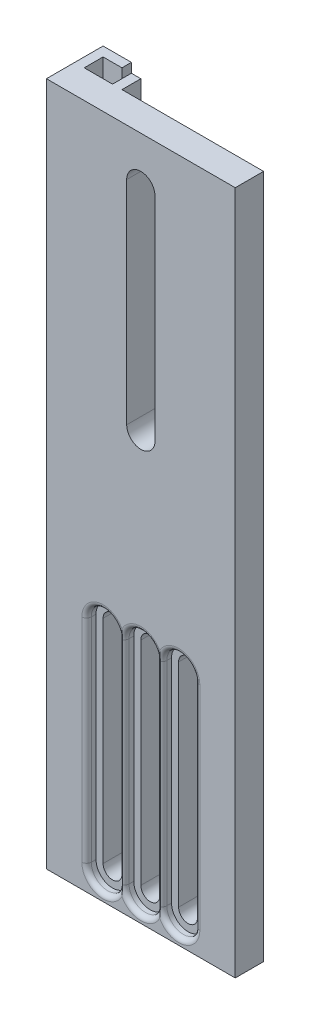
from build123d import *

# Parameters (mm, degrees)
SKETCH_1_W          = 40
SKETCH_1_H          = 160
EXTRUDE_2_DEPTH     = 6
CUT_EXTRUDE_3_DEPTH = 10
SKETCH_5_W          = 40
SKETCH_5_H          = 15
CUT_EXTRUDE_4_DEPTH = 10
CUT_EXTRUDE_5_DEPTH = 10
CUT_EXTRUDE_6_DEPTH = 2
FILLET_1_R          = 1
SKETCH_10_W         = 10
SKETCH_10_H         = 60
EXTRUDE_3_DEPTH     = 4
SKETCH_11_W         = 6
SKETCH_11_H         = 60
CUT_EXTRUDE_7_DEPTH = 4
SKETCH_13_W         = 6
SKETCH_13_H         = 29
EXTRUDE_9_DEPTH     = 2


with BuildPart() as part:
    # Эскиз1 → Бобышка-Вытянуть2 (new body)
    with BuildSketch(Plane.XY):
        Rectangle(SKETCH_1_W, SKETCH_1_H)
    extrude(amount=EXTRUDE_2_DEPTH)

    # Эскиз3 → Вырез-Вытянуть3 (cut)
    with BuildSketch(Plane.XY.offset(6)):
        with BuildLine():
            Line((-3, 55), (-3, 10))
            ThreePointArc((-3, 10), (0, 7), (3, 10))
            Line((3, 10), (3, 55))
            ThreePointArc((3, 55), (0, 58), (-3, 55))
        make_face()
    extrude(amount=-CUT_EXTRUDE_3_DEPTH, mode=Mode.SUBTRACT)

    # Эскиз5 → Вырез-Вытянуть4 (cut)
    with BuildSketch(Plane.XY.offset(6)):
        with Locations((0, 72.5)):
            Rectangle(SKETCH_5_W, SKETCH_5_H)
    extrude(amount=-CUT_EXTRUDE_4_DEPTH, mode=Mode.SUBTRACT)

    # Эскиз7 → Вырез-Вытянуть5 (cut)
    with BuildSketch(Plane.XY.offset(6)):
        with BuildLine():
            Line((-10, -30), (-10, -75))
            ThreePointArc((-10, -75), (-8, -77), (-6, -75))
            Line((-6, -75), (-6, -30))
            ThreePointArc((-6, -30), (-8, -28), (-10, -30))
        make_face()
        with BuildLine():
            Line((-2, -75), (-2, -30))
            ThreePointArc((-2, -30), (0, -28), (2, -30))
            Line((2, -30), (2, -75))
            ThreePointArc((2, -75), (0, -77), (-2, -75))
        make_face()
        with BuildLine():
            Line((6, -75), (6, -30))
            ThreePointArc((6, -30), (8, -28), (10, -30))
            Line((10, -30), (10, -75))
            ThreePointArc((10, -75), (8, -77), (6, -75))
        make_face()
    extrude(amount=-CUT_EXTRUDE_5_DEPTH, mode=Mode.SUBTRACT)

    # Эскиз8 → Вырез-Вытянуть6 (cut)
    # profile 1 of 3: a face of its own
    with BuildSketch(Plane.XY.offset(6)):
        with BuildLine():
            ThreePointArc((-11.5, -30), (-8, -26.5), (-4.5, -30))
            Line((-4.5, -30), (-4.5, -75))
            ThreePointArc((-4.5, -75), (-8, -78.5), (-11.5, -75))
            Line((-11.5, -75), (-11.5, -30))
        make_face()
        with BuildLine():
            Line((-10, -75), (-10, -30))
            ThreePointArc((-10, -30), (-8, -28), (-6, -30))
            Line((-6, -30), (-6, -75))
            ThreePointArc((-6, -75), (-8, -77), (-10, -75))
        make_face(mode=Mode.SUBTRACT)
    # profile 2 of 3: a face of its own
    with BuildSketch(Plane.XY.offset(6)):
        with BuildLine():
            ThreePointArc((-3.5, -30), (0, -26.5), (3.5, -30))
            Line((3.5, -30), (3.5, -75))
            ThreePointArc((3.5, -75), (0, -78.5), (-3.5, -75))
            Line((-3.5, -75), (-3.5, -30))
        make_face()
        with BuildLine():
            ThreePointArc((2, -75), (0, -77), (-2, -75))
            Line((-2, -75), (-2, -30))
            ThreePointArc((-2, -30), (0, -28), (2, -30))
            Line((2, -30), (2, -75))
        make_face(mode=Mode.SUBTRACT)
    # profile 3 of 3: a face of its own
    with BuildSketch(Plane.XY.offset(6)):
        with BuildLine():
            ThreePointArc((4.5, -30), (8, -26.5), (11.5, -30))
            Line((11.5, -30), (11.5, -75))
            ThreePointArc((11.5, -75), (8, -78.5), (4.5, -75))
            Line((4.5, -75), (4.5, -30))
        make_face()
        with BuildLine():
            Line((6, -75), (6, -30))
            ThreePointArc((6, -30), (8, -28), (10, -30))
            Line((10, -30), (10, -75))
            ThreePointArc((10, -75), (8, -77), (6, -75))
        make_face(mode=Mode.SUBTRACT)
    extrude(amount=-CUT_EXTRUDE_6_DEPTH, mode=Mode.SUBTRACT)

    # Скругление1
    # the kernel refuses this fillet: 1 mm, written as the material it takes off along each edge
    with BuildSketch(Plane(origin=(-8, -30, 6), x_dir=(-1, 0, 0), z_dir=(0, -1, 0))) as fillet_1_piece_1:
        with BuildLine():
            CenterArc((3.5 + FILLET_1_R, FILLET_1_R), FILLET_1_R, 180, 90)
            Line((3.5, FILLET_1_R), (3.5, 0))
            Line((3.5, 0), (3.5 + FILLET_1_R, 0))
        make_face()
    revolve(axis=Axis((-8, -30, 6), (0, 0, -1)), revolution_arc=180, mode=Mode.SUBTRACT)
    with BuildSketch(Plane(origin=(-11.5, -75, 6), x_dir=(-1, 0, 0), z_dir=(0, 1, 0)), Plane(origin=(-4.5, -30, 6), x_dir=(1, 0, 0), z_dir=(0, -1, 0)), Plane(origin=(3.5, -30, 6), x_dir=(1, 0, 0), z_dir=(0, -1, 0)), Plane(origin=(-3.5, -75, 6), x_dir=(-1, 0, 0), z_dir=(0, 1, 0)), Plane(origin=(11.5, -30, 6), x_dir=(1, 0, 0), z_dir=(0, -1, 0)), Plane(origin=(4.5, -75, 6), x_dir=(-1, 0, 0), z_dir=(0, 1, 0))) as fillet_1_piece_2:
        with BuildLine():
            CenterArc((FILLET_1_R, -FILLET_1_R), FILLET_1_R, 90, 90)
            Line((0, -FILLET_1_R), (0, 0))
            Line((0, 0), (FILLET_1_R, 0))
        make_face()
    extrude(amount=45, mode=Mode.SUBTRACT)
    with BuildSketch(Plane(origin=(-8, -75, 6), x_dir=(1, 0, 0), z_dir=(0, 1, 0))) as fillet_1_piece_3:
        with BuildLine():
            CenterArc((3.5 + FILLET_1_R, FILLET_1_R), FILLET_1_R, 180, 90)
            Line((3.5, FILLET_1_R), (3.5, 0))
            Line((3.5, 0), (3.5 + FILLET_1_R, 0))
        make_face()
    revolve(axis=Axis((-8, -75, 6), (0, 0, -1)), revolution_arc=180, mode=Mode.SUBTRACT)
    with BuildSketch(Plane(origin=(0, -30, 6), x_dir=(-1, 0, 0), z_dir=(0, -1, 0))) as fillet_1_piece_4:
        with BuildLine():
            CenterArc((3.5 + FILLET_1_R, FILLET_1_R), FILLET_1_R, 180, 90)
            Line((3.5, FILLET_1_R), (3.5, 0))
            Line((3.5, 0), (3.5 + FILLET_1_R, 0))
        make_face()
    revolve(axis=Axis((0, -30, 6), (0, 0, -1)), revolution_arc=180, mode=Mode.SUBTRACT)
    with BuildSketch(Plane(origin=(0, -75, 6), x_dir=(1, 0, 0), z_dir=(0, 1, 0))) as fillet_1_piece_5:
        with BuildLine():
            CenterArc((3.5 + FILLET_1_R, FILLET_1_R), FILLET_1_R, 180, 90)
            Line((3.5, FILLET_1_R), (3.5, 0))
            Line((3.5, 0), (3.5 + FILLET_1_R, 0))
        make_face()
    revolve(axis=Axis((0, -75, 6), (0, 0, -1)), revolution_arc=180, mode=Mode.SUBTRACT)
    with BuildSketch(Plane(origin=(8, -30, 6), x_dir=(-1, 0, 0), z_dir=(0, -1, 0))) as fillet_1_piece_6:
        with BuildLine():
            CenterArc((3.5 + FILLET_1_R, FILLET_1_R), FILLET_1_R, 180, 90)
            Line((3.5, FILLET_1_R), (3.5, 0))
            Line((3.5, 0), (3.5 + FILLET_1_R, 0))
        make_face()
    revolve(axis=Axis((8, -30, 6), (0, 0, -1)), revolution_arc=180, mode=Mode.SUBTRACT)
    with BuildSketch(Plane(origin=(8, -75, 6), x_dir=(1, 0, 0), z_dir=(0, 1, 0))) as fillet_1_piece_7:
        with BuildLine():
            CenterArc((3.5 + FILLET_1_R, FILLET_1_R), FILLET_1_R, 180, 90)
            Line((3.5, FILLET_1_R), (3.5, 0))
            Line((3.5, 0), (3.5 + FILLET_1_R, 0))
        make_face()
    revolve(axis=Axis((8, -75, 6), (0, 0, -1)), revolution_arc=180, mode=Mode.SUBTRACT)

    # Эскиз10 → Бобышка-Вытянуть3 (add)
    with BuildSketch(Plane(origin=(0, 0, 0), x_dir=(-1, 0, 0), z_dir=(0, 0, -1))):
        with Locations((15, 35)):
            Rectangle(SKETCH_10_W, SKETCH_10_H)
    extrude(amount=EXTRUDE_3_DEPTH)

    # Эскиз11 → Вырез-Вытянуть7 (cut)
    with BuildSketch(Plane(origin=(0, 0, -4), x_dir=(-1, 0, 0), z_dir=(0, 0, -1))):
        with Locations((15, 35)):
            Rectangle(SKETCH_11_W, SKETCH_11_H)
    extrude(amount=-CUT_EXTRUDE_7_DEPTH, mode=Mode.SUBTRACT)

    # Эскиз13 → Бобышка-Вытянуть9 (add)
    with BuildSketch(Plane(origin=(0, 0, -4), x_dir=(-1, 0, 0), z_dir=(0, 0, -1))):
        with Locations((17, 50.5)):
            Rectangle(SKETCH_13_W, SKETCH_13_H)
        with Locations((13, 19.5)):
            Rectangle(SKETCH_13_W, SKETCH_13_H)
    extrude(amount=EXTRUDE_9_DEPTH)


solid = part.part
